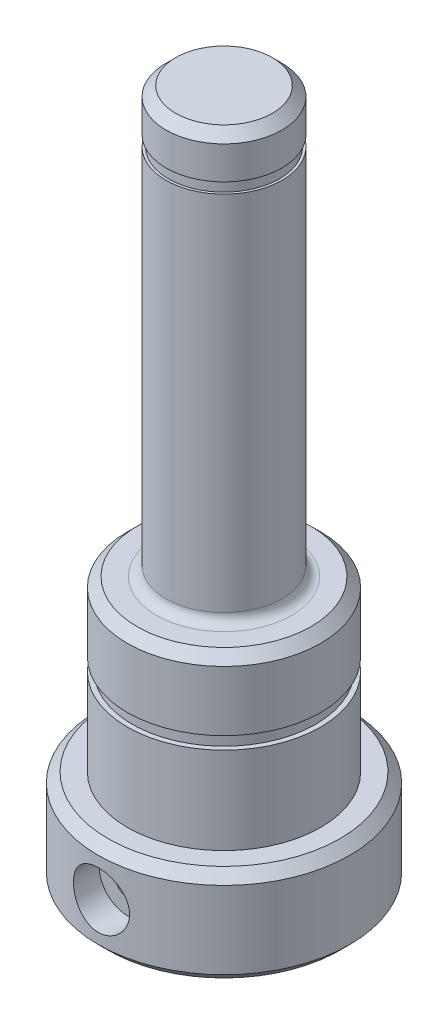
from build123d import *

# Parameters (mm, degrees)
FILLET2_R          = 1
CHAMFER1_SIZE      = 1
SKETCH5_R          = 5.05
CUT_EXTRUDE4_DEPTH = 20
SKETCH3_R          = 2.9
CUT_EXTRUDE3_DEPTH = 3


with BuildPart() as part:
    # Sketch1 → Revolve1 (revolve)
    with BuildSketch(Plane.XY):
        Polygon((0, 0), (-13, 0), (-13, 10), (-10, 10), (-10, 19), (-9.5, 19), (-9.5, 20.3), (-10, 20.3), (-10, 27.5), (-6, 27.5), (-6, 66), (-5.75, 66), (-5.75, 67.1), (-6, 67.1), (-6, 71.5), (0, 71.5), align=None)
    revolve(axis=Axis((0, 0, 0), (0, 1, 0)))

    # Fillet2
    fillet2_edges = [part.edges().sort_by_distance(p)[0] for p in [
        (6, 27.5, 0),
    ]]
    fillet(fillet2_edges, radius=FILLET2_R)

    # Chamfer1
    chamfer1_edges = [part.edges().sort_by_distance(p)[0] for p in [
        (10, 27.5, 0),
        (6, 71.5, 0),
        (13, 0, 0),
        (13, 10, 0),
    ]]
    chamfer(chamfer1_edges, length=CHAMFER1_SIZE)

    # Sketch5 → Cut-Extrude4 (cut)
    with BuildSketch(Plane.XZ):
        Circle(SKETCH5_R)
    extrude(amount=-CUT_EXTRUDE4_DEPTH, mode=Mode.SUBTRACT)

    # Sketch3 → Cut-Extrude3 (cut)
    with BuildSketch(Plane.XY.offset(13)):
        with Locations((0, 5)):
            Circle(SKETCH3_R)
    extrude(amount=-CUT_EXTRUDE3_DEPTH, mode=Mode.SUBTRACT)

    # Sketch8 → Tap Drill for M3 Tap1 (revolve, cut)
    with BuildSketch(Plane(origin=(0, 5, 10), x_dir=(0, -1, 0), z_dir=(1, 0, 0))):
        Polygon((0, 0), (0, 8.751075774), (1.25, 8), (1.25, 0), align=None)
    revolve(axis=Axis((0, 5, 16.35), (0, 0, -1)), mode=Mode.SUBTRACT)


solid = part.part
